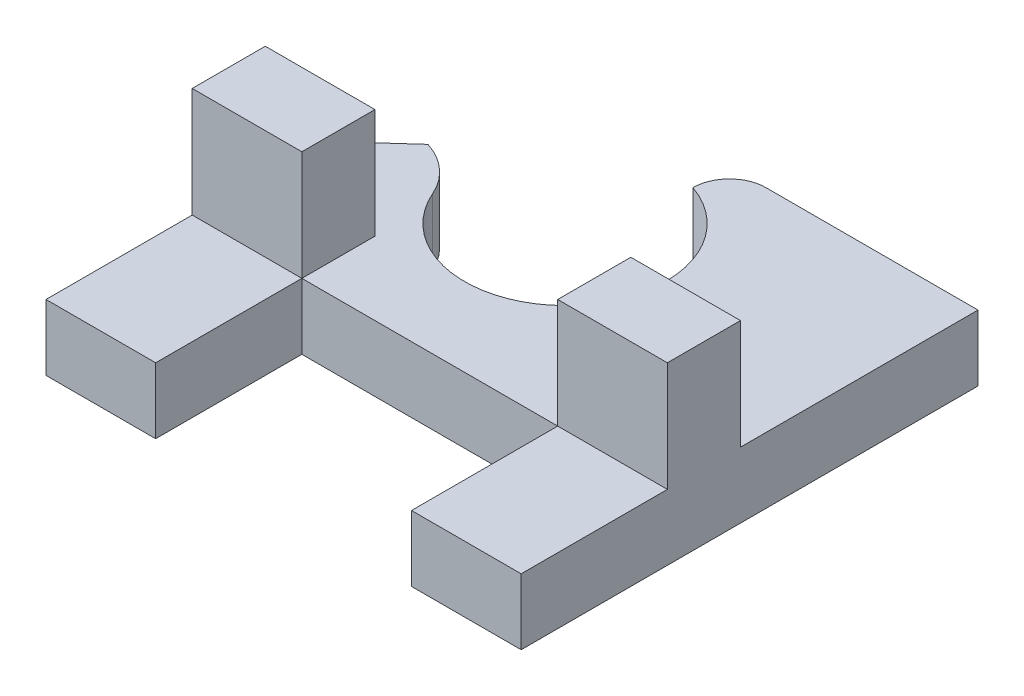
from build123d import *

# Parameters (mm, degrees)
BOSS_EXTRUDE1_DEPTH = 1.8
FILLET1_R           = 2
FILLET3_R           = 1
SKETCH2_W           = 3
SKETCH2_H           = 2
BOSS_EXTRUDE2_DEPTH = 3


# Some blends are built 0.0001 mm under size
with BuildPart() as part:
    # Sketch1 → Boss-Extrude1 (new body)
    with BuildSketch(Plane(origin=(0, 0, 0), x_dir=(1, 0, 0), z_dir=(0, 1, 0))):
        with BuildLine():
            Line((6.5, 2.5), (6.5, 0))
            Line((6.5, 0), (6.5, -4))
            Line((6.5, -4), (3.5, -4))
            Line((3.5, -4), (3.5, 0))
            Line((3.5, 0), (-3.5, 0))
            Line((-3.5, 0), (-3.5, -4))
            Line((-3.5, -4), (-6.5, -4))
            Line((-6.5, -4), (-6.5, 0))
            Line((-6.5, 0), (-6.5, 2.5))
            Line((-6.5, 2.5), (-6.5, 3.5))
            Line((-6.5, 3.5), (-4.95, 4.9))
            Line((-4.95, 4.9), (-3.95, 4.9))
            ThreePointArc((-3.95, 4.9), (-1.2, 2.15), (1.55, 4.9))
            ThreePointArc((1.55, 4.9), (1.040256682, 6.494913791), (-0.3, 7.498557292))
            Line((-0.3, 7.498557292), (-0.3, 8.498557292))
            Line((-0.3, 8.498557292), (6.5, 8.498557292))
            Line((6.5, 8.498557292), (6.5, 4.9))
            Line((6.5, 4.9), (6.5, 2.5))
        make_face()
    extrude(amount=BOSS_EXTRUDE1_DEPTH)

    # Fillet1
    # the kernel refuses this fillet: 2 mm, written as the material it takes off along each edge
    with BuildSketch(Plane(origin=(-3.95, -2.821440468, -4.9), x_dir=(0.20519567041703113, 0, 0.9787209698591858), z_dir=(0, 1, 0))) as fillet1_piece_1:
        with BuildLine():
            CenterArc((1.538967528, -1.95744194), FILLET1_R, 101.840953646, 48.860489585)
            Line((-0.20519567, -0.97872097), (-0.240078934, -0.95914655))
            ThreePointArc((-0.240078934, -0.95914655), (-0.141746674, -0.481152658), (-0.039148839, 0.008207827))
            Line((-0.039148839, 0.008207827), (0.008207827, 0.039148839))
            ThreePointArc((0.008207827, 0.039148839), (0.564288094, -0.018517333), (1.12036836, 0.039148839))
            Line((1.12036836, 0.039148839), (1.128576187, 0))
        make_face()
    extrude(amount=7.442880936, mode=Mode.SUBTRACT)

    # Fillet3
    fillet3_edges = [part.edges().sort_by_distance(p)[0] for p in [
        (-0.3, 0.9, -8.498557292),
    ]]
    fillet(fillet3_edges, radius=FILLET3_R - 0.0001)  # a hair under: the kernel refuses the full size

    # Sketch2 → Boss-Extrude2 (add)
    with BuildSketch(Plane.XZ):
        with Locations((5, -1)):
            Rectangle(SKETCH2_W, SKETCH2_H)
        with Locations((-5, -1)):
            Rectangle(SKETCH2_W, SKETCH2_H)
    extrude(amount=BOSS_EXTRUDE2_DEPTH)


with BuildPart() as body_2:
    # Mirror3: mirrored copy
    add(part.part.mirror(Plane(origin=(0, 0, 0), x_dir=(0, 0, 1), z_dir=(0, -1, 0))))


solid = body_2.part
